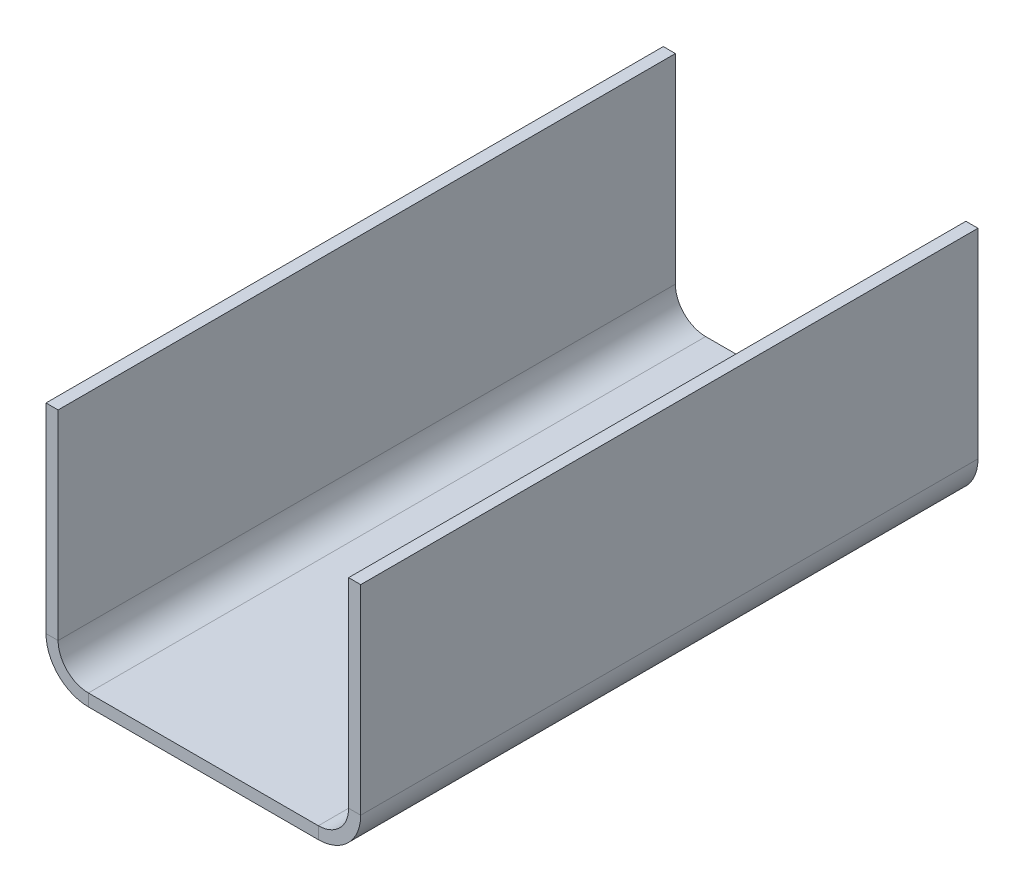
from build123d import *

# Parameters (mm, degrees)
TABAN_FLAN_1_DEPTH = 510


# Sheet-metal steps are written as plain solids
with BuildPart() as part:
    # Çizim1 → Taban-Flanş1 (new body)
    with BuildSketch(Plane.XY):
        with BuildLine():
            Line((0, 0), (0, -165))
            ThreePointArc((0, -165), (7.32233047, -182.67766953), (25, -190))
            Line((25, -190), (215, -190))
            ThreePointArc((215, -190), (232.67766953, -182.67766953), (240, -165))
            Line((240, -165), (240, 0))
            Line((240, 0), (250, 0))
            Line((250, 0), (250, -165))
            ThreePointArc((250, -165), (239.748737342, -189.748737342), (215, -200))
            Line((215, -200), (25, -200))
            ThreePointArc((25, -200), (0.251262658, -189.748737342), (-10, -165))
            Line((-10, -165), (-10, 0))
            Line((-10, 0), (0, 0))
        make_face()
    extrude(amount=TABAN_FLAN_1_DEPTH)


solid = part.part
